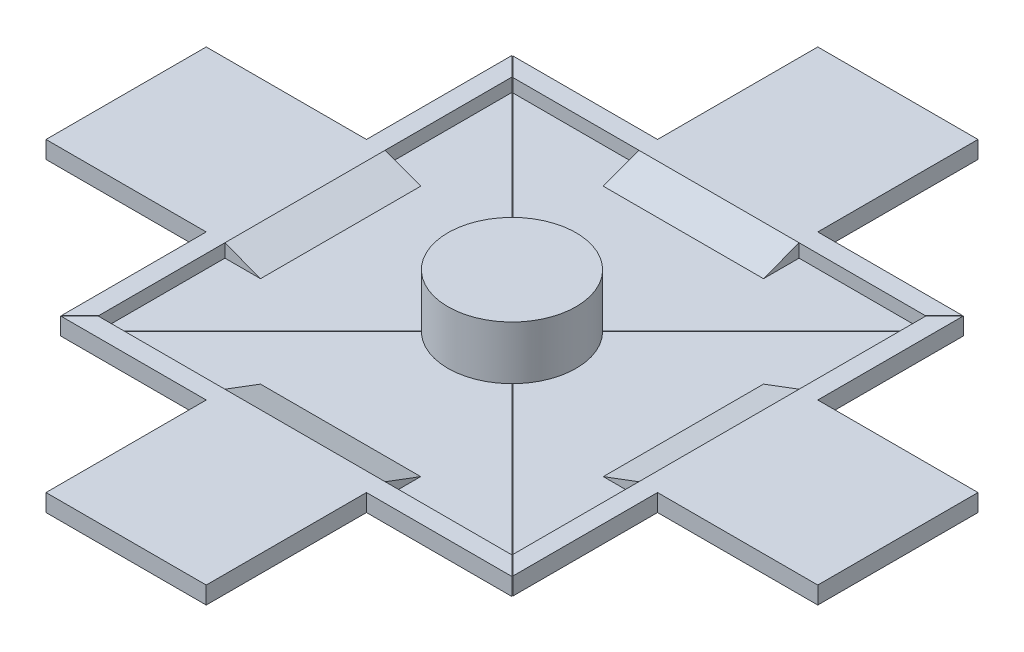
from build123d import *

# Parameters (mm, degrees)
PLYWOOD_BASE_DEPTH           = 19.05
FIELD_LAYOUT_3_W             = 1968.5
FIELD_LAYOUT_3_H             = 1968.5
RAISED_BASE_DEPTH            = 63.5
FIELD_LAYOUT_4_W             = 762
FIELD_LAYOUT_4_H             = 169.138249808
RAMP_EXTRUDE_DEPTH           = 63.5
CUT_RAMP_SLOPE_REACH         = 2880.042
COPY_RAMP_SLOPE_COUNT        = 4
SKETCH5_R                    = 304.8
BOSS_EXTRUDE1_DEPTH          = 254
CUT_EXTRUDE_THIN1_DEPTH      = 2608.693817341
CUT_EXTRUDE_THIN1_DEPTH_BACK = 2608.693817341


with BuildPart() as part:
    # Field Layout → Plywood Base (new body)
    with BuildSketch(Plane(origin=(0, 0, 0), x_dir=(1, 0, 0), z_dir=(0, 1, 0))):
        Polygon((-381, 1073.15), (-1073.15, 1073.15), (-1073.15, 381), (-1835.15, 381), (-1835.15, -381), (-1073.15, -381), (-1073.15, -1073.15), (-381, -1073.15), (-381, -1835.15), (381, -1835.15), (381, -1073.15), (1073.15, -1073.15), (1073.15, -381), (1835.15, -381), (1835.15, 381), (1073.15, 381), (1073.15, 1073.15), (381, 1073.15), (381, 1835.15), (-381, 1835.15), align=None)
    extrude(amount=-PLYWOOD_BASE_DEPTH)

    # Field Layout<3> → Raised Base (add)
    with BuildSketch(Plane(origin=(0, 0, 0), x_dir=(1, 0, 0), z_dir=(0, 1, 0))):
        Polygon((-381, 1073.15), (-1073.15, 1073.15), (-1073.15, 381), (-1835.15, 381), (-1835.15, -381), (-1073.15, -381), (-1073.15, -1073.15), (-381, -1073.15), (-381, -1835.15), (381, -1835.15), (381, -1073.15), (1073.15, -1073.15), (1073.15, -381), (1835.15, -381), (1835.15, 381), (1073.15, 381), (1073.15, 1073.15), (381, 1073.15), (381, 1835.15), (-381, 1835.15), align=None)
        Rectangle(FIELD_LAYOUT_3_W, FIELD_LAYOUT_3_H, mode=Mode.SUBTRACT)
    extrude(amount=RAISED_BASE_DEPTH)

    # Field Layout<4> → Ramp Extrude (add)
    with BuildSketch(Plane(origin=(0, 0, 0), x_dir=(1, 0, 0), z_dir=(0, 1, 0))):
        with Locations((0, -899.680875096)):
            Rectangle(FIELD_LAYOUT_4_W, FIELD_LAYOUT_4_H)
    ramp_extrude = extrude(amount=RAMP_EXTRUDE_DEPTH)

    # Sketch3 → Cut ramp slope (cut, up to next)
    with BuildSketch(Plane(origin=(381, 0, 0), x_dir=(0, 0, -1), z_dir=(1, 0, 0)), mode=Mode.PRIVATE) as cut_ramp_slope_sk1:
        Polygon((-815.111750192, 63.5), (-984.25, 63.5), (-815.111750192, 0), align=None)
    cut_ramp_slope_tool1 = extrude(cut_ramp_slope_sk1.sketch, amount=-CUT_RAMP_SLOPE_REACH, mode=Mode.PRIVATE) & part.part
    cut_ramp_slope = cut_ramp_slope_tool1.solids().sort_by_distance((381, 42.333333, 871.491167))[0]
    add(cut_ramp_slope, mode=Mode.SUBTRACT)

    # Copy Ramp Slope: Ramp Extrude, Cut ramp slope ×4 about axis
    copy_ramp_slope_axis = Axis((0, -19.05, 0), (0, -1, 0))
    add([ramp_extrude.rotate(copy_ramp_slope_axis, i * 360 / COPY_RAMP_SLOPE_COUNT) for i in range(1, COPY_RAMP_SLOPE_COUNT)])
    add([cut_ramp_slope.rotate(copy_ramp_slope_axis, i * 360 / COPY_RAMP_SLOPE_COUNT) for i in range(1, COPY_RAMP_SLOPE_COUNT)], mode=Mode.SUBTRACT)

    # Sketch4 → Cut-Extrude-Thin1 (cut, two sides: drawn at the far end of the back side and taken through both)
    with BuildSketch(Plane(origin=(0, 0, 0), x_dir=(1, 0, 0), z_dir=(0, 1, 0)).offset(-CUT_EXTRUDE_THIN1_DEPTH_BACK)):
        Polygon((-1073.15, -1073.15), (-984.25, -984.25), (984.25, 984.25), (1073.15, 1073.15), (1071.353948776, 1074.946051224), (982.453948776, 986.046051224), (-986.046051224, -982.453948776), (-1074.946051224, -1071.353948776), align=None)
        Polygon((-1073.15, 1073.15), (-984.25, 984.25), (984.25, -984.25), (1073.15, -1073.15), (1074.946051224, -1071.353948776), (986.046051224, -982.453948776), (-982.453948776, 986.046051224), (-1071.353948776, 1074.946051224), align=None)
    extrude(amount=CUT_EXTRUDE_THIN1_DEPTH + CUT_EXTRUDE_THIN1_DEPTH_BACK, mode=Mode.SUBTRACT)


with BuildPart() as body_2:
    # Sketch5 → Boss-Extrude1 (new body)
    with BuildSketch(Plane(origin=(0, 0, 0), x_dir=(1, 0, 0), z_dir=(0, 1, 0))):
        Circle(SKETCH5_R)
    extrude(amount=BOSS_EXTRUDE1_DEPTH)


with BuildPart() as cut_extrude_thin1_piece_1:
    # of the separate pieces the step leaves, piece 1, a body of its own (cut_extrude_thin1_pieces)
    add(part.part.solids().sort_by_distance((0, -19.05, 0))[0])


with BuildPart() as cut_extrude_thin1_piece_2:
    # of the separate pieces the step leaves, piece 2, a body of its own (cut_extrude_thin1_pieces)
    add(part.part.solids().sort_by_distance((-1073.15, -19.05, -1073.15))[0])


with BuildPart() as cut_extrude_thin1_piece_3:
    # of the separate pieces the step leaves, piece 3, a body of its own (cut_extrude_thin1_pieces)
    add(part.part.solids().sort_by_distance((1073.15, 63.5, -381))[0])


with BuildPart() as cut_extrude_thin1_piece_4:
    # of the separate pieces the step leaves, piece 4, a body of its own (cut_extrude_thin1_pieces)
    add(part.part.solids().sort_by_distance((-381, 63.5, -1073.15))[0])


solid = Compound([body_2.part, cut_extrude_thin1_piece_1.part, cut_extrude_thin1_piece_2.part, cut_extrude_thin1_piece_3.part, cut_extrude_thin1_piece_4.part])
